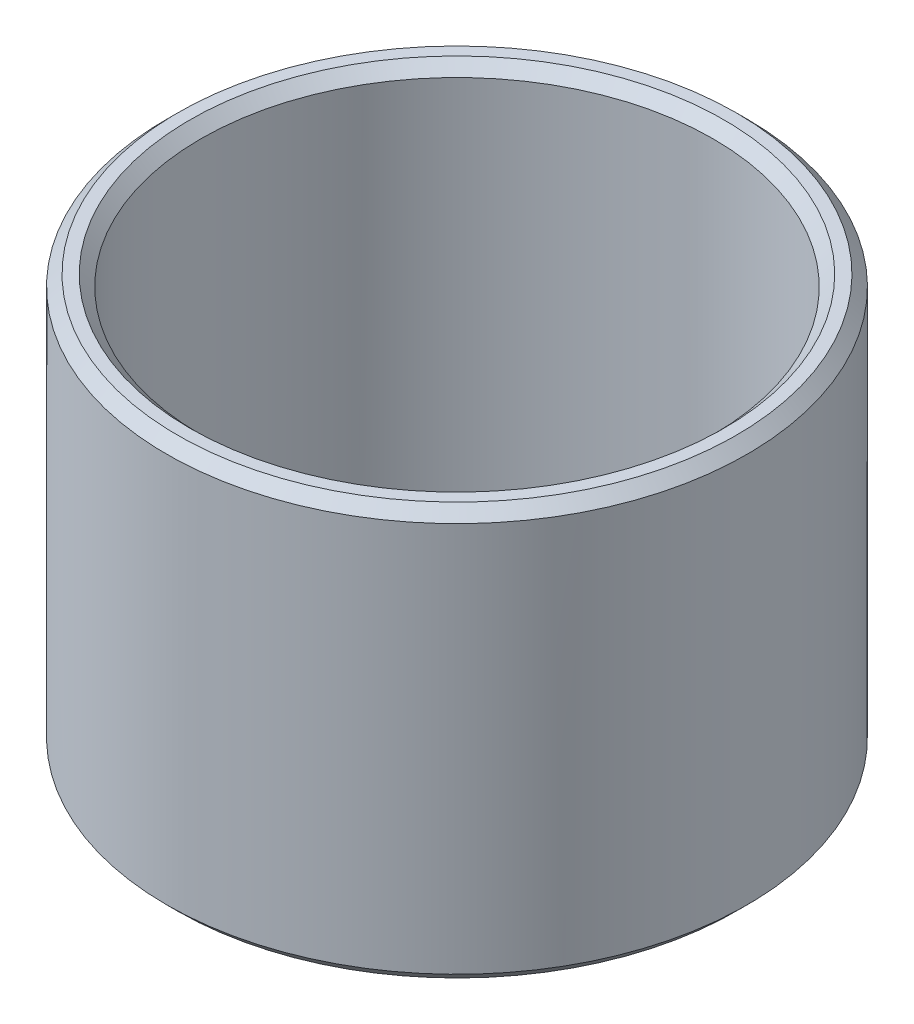
from build123d import *

# Parameters (mm, degrees)
SKETCH1_R           = 50
BOSS_EXTRUDE1_DEPTH = 70.998474476
SKETCH2_R           = 44.130605192
CUT_EXTRUDE1_DEPTH  = 101.203709402
CHAMFER1_SIZE       = 1.88484915


with BuildPart() as part:
    # Sketch1 → Boss-Extrude1 (new body)
    with BuildSketch(Plane(origin=(0, 0, 0), x_dir=(1, 0, 0), z_dir=(0, 1, 0))):
        Circle(SKETCH1_R)
    extrude(amount=BOSS_EXTRUDE1_DEPTH)

    # Sketch2 → Cut-Extrude1 (cut, through all)
    with BuildSketch(Plane(origin=(0, 0, 0), x_dir=(1, 0, 0), z_dir=(0, 1, 0))):
        Circle(SKETCH2_R)
    extrude(amount=CUT_EXTRUDE1_DEPTH, mode=Mode.SUBTRACT)

    # Chamfer1
    chamfer1_edges = [part.edges().sort_by_distance(p)[0] for p in [
        (-44.130605192, 70.998474476, 0),
        (-44.130605192, 0, 0),
        (-50, 0, 0),
        (-50, 70.998474476, 0),
    ]]
    chamfer(chamfer1_edges, length=CHAMFER1_SIZE)


solid = part.part
